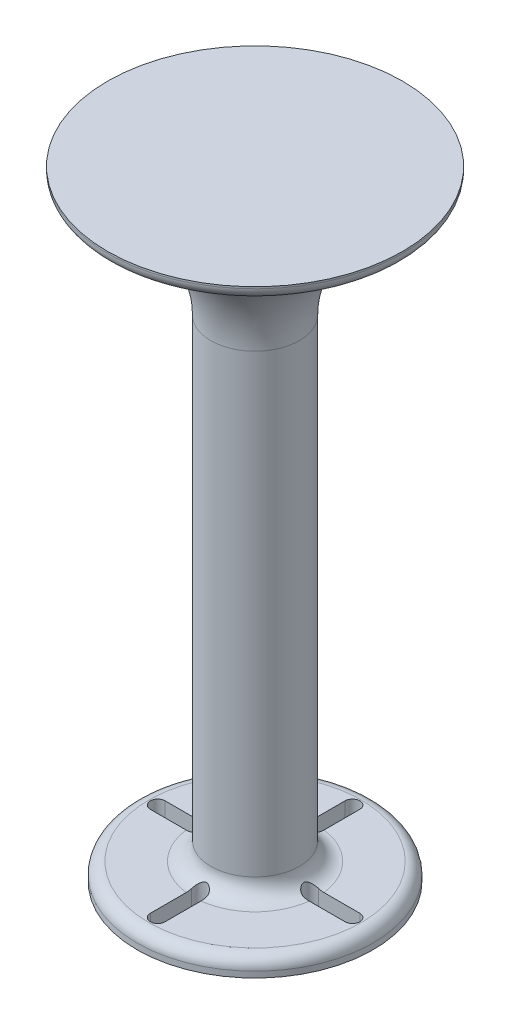
from build123d import *

# Parameters (mm, degrees)
SKETCH1_R           = 20
BOSS_EXTRUDE1_DEPTH = 3
SKETCH2_R           = 7.5
BOSS_EXTRUDE2_DEPTH = 100
SKETCH3_R           = 25
BOSS_EXTRUDE3_DEPTH = 2
FILLET3_R           = 20
FILLET4_R           = 2
FILLET6_R           = 3
CUT_EXTRUDE1_REACH  = 112.793
FILLET8_R           = 2


with BuildPart() as part:
    # Sketch1 → Boss-Extrude1 (new body)
    with BuildSketch(Plane(origin=(0, 0, 0), x_dir=(1, 0, 0), z_dir=(0, 1, 0))):
        with Locations(Location((0, 0, 0), (0, 0, 270))):
            Circle(SKETCH1_R)
    extrude(amount=BOSS_EXTRUDE1_DEPTH)

    # Sketch2 → Boss-Extrude2 (add)
    with BuildSketch(Plane(origin=(0, 3, 0), x_dir=(1, 0, 0), z_dir=(0, 1, 0))):
        with Locations(Location((0, 0, 0), (0, 0, 270))):
            Circle(SKETCH2_R)
    extrude(amount=BOSS_EXTRUDE2_DEPTH)

    # Sketch3 → Boss-Extrude3 (add)
    with BuildSketch(Plane(origin=(0, 103, 0), x_dir=(1, 0, 0), z_dir=(0, 1, 0))):
        with Locations(Location((0, 0, 0), (0, 0, 270))):
            Circle(SKETCH3_R)
    extrude(amount=BOSS_EXTRUDE3_DEPTH)

    # Fillet3
    # the kernel refuses this fillet: 20 mm, written as the material it adds along each edge
    with BuildSketch(Plane(origin=(0, 103, 0), x_dir=(0, 0, 1), z_dir=(-1, 0, 0))) as fillet3_piece_1:
        with BuildLine():
            CenterArc((27.5, -19.843134833), FILLET3_R, 97.180755781, 82.819244219)
            Line((7.5, -19.843134833), (7.1, -19.843134833))
            Line((7.1, -19.843134833), (7.1, 0))
            Line((7.1, 0), (7.5, 0.4))
            ThreePointArc((7.5, 0.4), (16.25, 0.4), (24.95, 0.396862697))
            Line((24.95, 0.396862697), (25, 0))
        make_face()
    revolve(axis=Axis((0, 103, 0), (0, 1, 0)))

    # Fillet4
    fillet4_edges = [part.edges().sort_by_distance(p)[0] for p in [
        (0, 103, -25),
    ]]
    fillet(fillet4_edges, radius=FILLET4_R)

    # Fillet6
    fillet6_edges = [part.edges().sort_by_distance(p)[0] for p in [
        (0, 3, -7.5),
    ]]
    fillet(fillet6_edges, radius=FILLET6_R)

    # Sketch4 → Cut-Extrude1 (cut, up to next)
    with BuildSketch(Plane.XZ, mode=Mode.PRIVATE) as cut_extrude1_sk1:
        with BuildLine():
            Line((-1.25, -16.5), (-1.25, -9.5))
            ThreePointArc((-1.25, -9.5), (0, -8.25), (1.25, -9.5))
            Line((1.25, -9.5), (1.25, -16.5))
            ThreePointArc((1.25, -16.5), (0, -17.75), (-1.25, -16.5))
        make_face()
    cut_extrude1_tool1 = extrude(cut_extrude1_sk1.sketch, amount=-CUT_EXTRUDE1_REACH, mode=Mode.PRIVATE) & part.part
    # Sketch4 → Cut-Extrude1 (cut, up to next)
    with BuildSketch(Plane.XZ, mode=Mode.PRIVATE) as cut_extrude1_sk2:
        with BuildLine():
            Line((-16.5, 1.25), (-9.5, 1.25))
            ThreePointArc((-9.5, 1.25), (-8.25, 0), (-9.5, -1.25))
            Line((-9.5, -1.25), (-16.5, -1.25))
            ThreePointArc((-16.5, -1.25), (-17.75, 0), (-16.5, 1.25))
        make_face()
    cut_extrude1_tool2 = extrude(cut_extrude1_sk2.sketch, amount=-CUT_EXTRUDE1_REACH, mode=Mode.PRIVATE) & part.part
    # Sketch4 → Cut-Extrude1 (cut, up to next)
    with BuildSketch(Plane.XZ, mode=Mode.PRIVATE) as cut_extrude1_sk3:
        with BuildLine():
            Line((1.25, 16.5), (1.25, 9.5))
            ThreePointArc((1.25, 9.5), (0, 8.25), (-1.25, 9.5))
            Line((-1.25, 9.5), (-1.25, 16.5))
            ThreePointArc((-1.25, 16.5), (0, 17.75), (1.25, 16.5))
        make_face()
    cut_extrude1_tool3 = extrude(cut_extrude1_sk3.sketch, amount=-CUT_EXTRUDE1_REACH, mode=Mode.PRIVATE) & part.part
    # Sketch4 → Cut-Extrude1 (cut, up to next)
    with BuildSketch(Plane.XZ, mode=Mode.PRIVATE) as cut_extrude1_sk4:
        with BuildLine():
            Line((16.5, -1.25), (9.5, -1.25))
            ThreePointArc((9.5, -1.25), (8.25, 0), (9.5, 1.25))
            Line((9.5, 1.25), (16.5, 1.25))
            ThreePointArc((16.5, 1.25), (17.75, 0), (16.5, -1.25))
        make_face()
    cut_extrude1_tool4 = extrude(cut_extrude1_sk4.sketch, amount=-CUT_EXTRUDE1_REACH, mode=Mode.PRIVATE) & part.part
    add(cut_extrude1_tool1.solids().sort_by_distance((0, 0, -13))[0], mode=Mode.SUBTRACT)
    add(cut_extrude1_tool2.solids().sort_by_distance((-13, 0, 0))[0], mode=Mode.SUBTRACT)
    add(cut_extrude1_tool3.solids().sort_by_distance((0, 0, 13))[0], mode=Mode.SUBTRACT)
    add(cut_extrude1_tool4.solids().sort_by_distance((13, 0, 0))[0], mode=Mode.SUBTRACT)

    # Fillet8
    fillet8_edges = [part.edges().sort_by_distance(p)[0] for p in [
        (0, 3, -20),
    ]]
    fillet(fillet8_edges, radius=FILLET8_R)


solid = part.part
